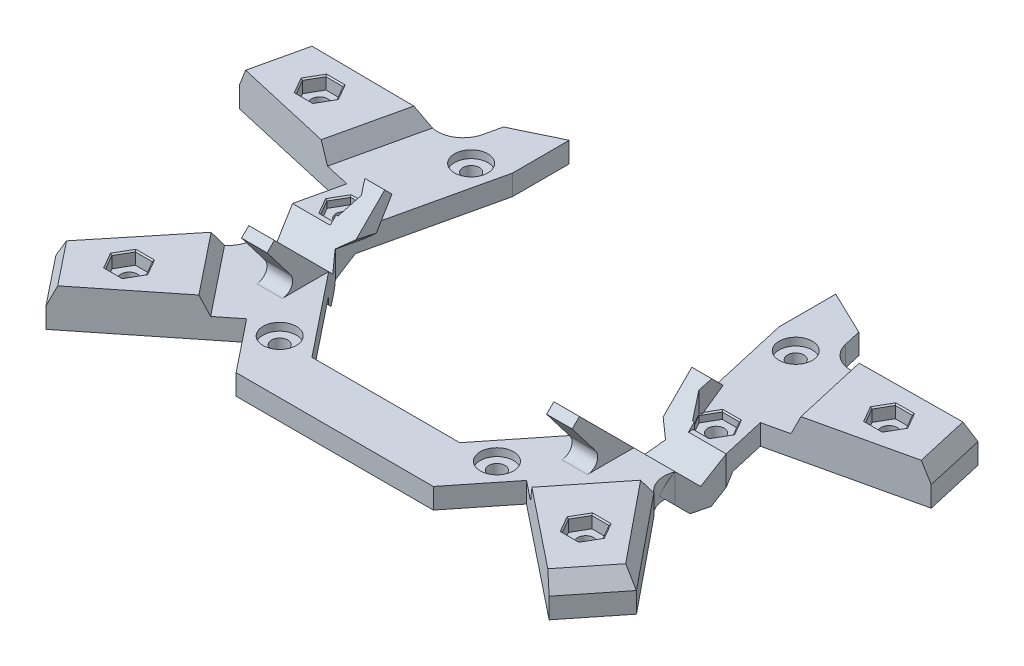
from build123d import *
from OCP.BRepFilletAPI import BRepFilletAPI_MakeChamfer

# Parameters (mm, degrees)
EXTRUDE_BASE_DEPTH  = 4
SKETCH16_R          = 1.6
CUT_EXTRUDE7_DEPTH  = 83.567171703
SKETCH17_R          = 2.85
CUT_EXTRUDE8_DEPTH  = 3
CUT_EXTRUDE9_DEPTH  = 83.567171703
SKETCH19_W          = 52.066048694
SKETCH19_H          = 44.396650567
CUT_EXTRUDE10_DEPTH = 83.567171703
CUT_EXTRUDE11_DEPTH = 45
BOSS_EXTRUDE1_START = -43.283534
BOSS_EXTRUDE1_DEPTH = 15.980374
BOSS_EXTRUDE2_START = 27.30316
BOSS_EXTRUDE2_DEPTH = 15.980374
CUT_EXTRUDE12_DEPTH = 83.857334274
CUT_EXTRUDE6_DEPTH  = 83.857334284
CUT_EXTRUDE13_DEPTH = 1.5
BOSS_EXTRUDE3_DEPTH = 3.5
SKETCH25_R          = 1.6
CUT_EXTRUDE14_DEPTH = 7.5
CUT_EXTRUDE15_DEPTH = 2.5
CHAMFER1_SIZE       = 1.632076804
CHAMFER1_SIZE_2     = 3.5
CHAMFER2_SIZE       = 0.25
SKETCH27_R          = 3.25
CUT_EXTRUDE16_DEPTH = 1.5
BOSS_EXTRUDE4_START = 27.30316
BOSS_EXTRUDE4_DEPTH = 5
BOSS_EXTRUDE5_START = -27.30316
BOSS_EXTRUDE5_DEPTH = 5
FILLET1_R           = 2
BOSS_EXTRUDE6_START = 30
BOSS_EXTRUDE6_DEPTH = 5
BOSS_EXTRUDE7_START = -30
BOSS_EXTRUDE7_DEPTH = 5
CUT_EXTRUDE17_DEPTH = 15
CHAMFER3_SIZE       = 2
SKETCH28_W          = 3.348631561
SKETCH28_H          = 0.74163265
SKETCH28_W_2        = 3.350976015
SKETCH28_H_2        = 1.173220137
CUT_EXTRUDE18_DEPTH = 5


# Some blends are built 0.0001 mm under size
with BuildPart() as part:
    # Sketch2 → Extrude_Base (new body)
    with BuildSketch(Plane(origin=(0, 0, 0), x_dir=(1, 0, 0), z_dir=(0, 1, 0))):
        with BuildLine():
            Line((-49.150553593, -47.254260988), (-27.345273547, -29.865130414))
            Line((-27.345273547, -29.865130414), (-19.262984752, -40))
            Line((-19.262984752, -40), (19.262984752, -40))
            Line((19.262984752, -40), (27.345273547, -29.865130414))
            Line((27.345273547, -29.865130414), (49.150553593, -47.254260988))
            Line((49.150553593, -47.254260988), (56.719719788, -37.762826791))
            Line((56.719719788, -37.762826791), (41.941046163, -19.581987814))
            ThreePointArc((41.941046163, -19.581987814), (40.089934123, -16.232652782), (41.14933776, -12.555381392))
            Line((41.14933776, -12.555381392), (43.283533845, -9.879184149))
            Line((43.283533845, -9.879184149), (40.398998371, 2.758791512))
            Line((40.398998371, 2.758791512), (67.589737842, 8.96490036))
            Line((67.589737842, 8.96490036), (64.888333704, 20.800525213))
            Line((64.888333704, 20.800525213), (41.459629124, 20.581660596))
            ThreePointArc((41.459629124, 20.581660596), (37.686864072, 21.222679161), (35.472384893, 24.343695487))
            Line((35.472384893, 24.343695487), (34.710699129, 27.680858865))
            Line((34.710699129, 27.680858865), (0, 44.396650567))
            Line((0, 44.396650567), (-34.710699129, 27.680858865))
            Line((-34.710699129, 27.680858865), (-35.472384893, 24.343695487))
            ThreePointArc((-35.472384893, 24.343695487), (-37.686864072, 21.222679161), (-41.459629124, 20.581660596))
            Line((-41.459629124, 20.581660596), (-64.888333704, 20.800525213))
            Line((-64.888333704, 20.800525213), (-67.589737842, 8.96490036))
            Line((-67.589737842, 8.96490036), (-40.398998371, 2.758791512))
            Line((-40.398998371, 2.758791512), (-43.283533845, -9.879184149))
            Line((-43.283533845, -9.879184149), (-41.14933776, -12.555381392))
            ThreePointArc((-41.14933776, -12.555381392), (-40.089934123, -16.232652782), (-41.941046163, -19.581987814))
            Line((-41.941046163, -19.581987814), (-56.719719788, -37.762826791))
            Line((-56.719719788, -37.762826791), (-49.150553593, -47.254260988))
        make_face()
    extrude(amount=EXTRUDE_BASE_DEPTH)

    # Sketch16 → Cut-Extrude7 (cut, through all)
    with BuildSketch(Plane(origin=(0, 4, 0), x_dir=(1, 0, 0), z_dir=(0, 1, 0))):
        with Locations(Location((-55.61963739, 12.694819282, 0), (0, 0, 270))):
            Circle(SKETCH16_R)
        with Locations(Location((55.61963739, 12.694819282, 0), (0, 0, 270))):
            Circle(SKETCH16_R)
        with Locations(Location((44.603486075, -35.570093196, 0), (0, 0, 270))):
            Circle(SKETCH16_R)
        with Locations(Location((-44.603486075, -35.570093196, 0), (0, 0, 270))):
            Circle(SKETCH16_R)
    extrude(amount=-CUT_EXTRUDE7_DEPTH, mode=Mode.SUBTRACT)

    # Sketch17 → Cut-Extrude8 (cut)
    with BuildSketch(Plane.XZ):
        with Locations(Location((-44.603486075, 35.570093196, 0), (0, 0, 270))):
            Circle(SKETCH17_R)
        with Locations(Location((55.61963739, -12.694819282, 0), (0, 0, 270))):
            Circle(SKETCH17_R)
        with Locations(Location((44.603486075, 35.570093196, 0), (0, 0, 270))):
            Circle(SKETCH17_R)
        with Locations(Location((-55.61963739, -12.694819282, 0), (0, 0, 270))):
            Circle(SKETCH17_R)
    extrude(amount=-CUT_EXTRUDE8_DEPTH, mode=Mode.SUBTRACT)

    # Sketch18 → Cut-Extrude9 (cut, through all)
    with BuildSketch(Plane(origin=(0, 4, 0), x_dir=(1, 0, 0), z_dir=(0, 1, 0))):
        Polygon((14.447238564, -30), (32.462650384, -7.409388112), (26.033024347, 20.760644149), (0, 33.297487925), (-26.033024347, 20.760644149), (-32.462650384, -7.409388112), (-14.447238564, -30), align=None)
    extrude(amount=-CUT_EXTRUDE9_DEPTH, mode=Mode.SUBTRACT)

    # Sketch19 → Cut-Extrude10 (cut, through all)
    with BuildSketch(Plane(origin=(0, 4, 0), x_dir=(1, 0, 0), z_dir=(0, 1, 0))):
        with Locations((0, 22.198325284)):
            Rectangle(SKETCH19_W, SKETCH19_H)
    extrude(amount=-CUT_EXTRUDE10_DEPTH, mode=Mode.SUBTRACT)

    # Sketch20 → Cut-Extrude11 (cut, symmetric)
    with BuildSketch(Plane(origin=(0, 0, 0), x_dir=(0, 0, -1), z_dir=(1, 0, 0))):
        Polygon((-2.855126894, 7.024057254), (-9.879184149, 0), (-16.903241403, 7.024057254), align=None)
    extrude(amount=CUT_EXTRUDE11_DEPTH, both=True, mode=Mode.SUBTRACT)


with BuildPart() as cut_extrude11_piece_1:
    # of the separate pieces the step leaves, piece 1, a body of its own (cut_extrude11_pieces)
    add(part.part.solids().sort_by_distance((-49.150553593, 0, 47.254260988))[0])



with BuildPart() as cut_extrude11_piece_2:
    # of the separate pieces the step leaves, piece 2, a body of its own (cut_extrude11_pieces)
    add(part.part.solids().sort_by_distance((32.462650384, 0, 7.409388112))[0])


with BuildPart() as cut_extrude11_piece_3:
    # of the separate pieces the step leaves, piece 3, a body of its own (cut_extrude11_pieces)
    add(part.part.solids().sort_by_distance((-40.398998371, 0, -2.758791512))[0])


with BuildPart() as cut_extrude11_piece_1_1:
    add(cut_extrude11_piece_1.part)

    add(cut_extrude11_piece_3.part)  # Boss-Extrude1 merges Cut-Extrude11 piece 3
    # Sketch20<3> → Boss-Extrude1 (add)
    with BuildSketch(Plane(origin=(0, 0, 0), x_dir=(0, 0, -1), z_dir=(1, 0, 0)).offset(BOSS_EXTRUDE1_START)):
        Polygon((-3.050757024, 1.171572875), (-5.879184149, 4), (-9.879184149, 0), (-13.879184149, 4), (-16.707611273, 1.171572875), (-11.536038398, -4), (-8.222329899, -4), align=None)
    extrude(amount=BOSS_EXTRUDE1_DEPTH)


    add(cut_extrude11_piece_2.part)  # Boss-Extrude2 merges Cut-Extrude11 piece 2
    # Sketch20<4> → Boss-Extrude2 (add)
    with BuildSketch(Plane(origin=(0, 0, 0), x_dir=(0, 0, -1), z_dir=(1, 0, 0)).offset(BOSS_EXTRUDE2_START)):
        Polygon((-3.050757024, 1.171572875), (-5.879184149, 4), (-9.879184149, 0), (-13.879184149, 4), (-16.707611273, 1.171572875), (-11.536038398, -4), (-8.222329899, -4), align=None)
    extrude(amount=BOSS_EXTRUDE2_DEPTH)

    # Sketch21 → Cut-Extrude12 (cut, through all)
    with BuildSketch(Plane(origin=(0, 4, 0), x_dir=(1, 0, 0), z_dir=(0, 1, 0))):
        with BuildLine():
            ThreePointArc((-40.058495173, -15.672830401), (-40.142397055, -14.760701407), (-40.391286893, -13.879184149))
            Line((-40.391286893, -13.879184149), (-42.370559948, -5.879184149))
            Line((-42.370559948, -5.879184149), (-40.398998371, 2.758791512))
            Line((-40.398998371, 2.758791512), (-45.604604003, 3.946937027))
            Line((-45.604604003, 3.946937027), (-47.84735204, -5.879184149))
            Line((-47.84735204, -5.879184149), (-44.042526576, -21.25786252))
            Line((-44.042526576, -21.25786252), (-43.640953756, -21.673227326))
            Line((-43.640953756, -21.673227326), (-41.941046163, -19.581987814))
            ThreePointArc((-41.941046163, -19.581987814), (-40.880219583, -18.419102984), (-40.233485879, -16.984045607))
            add(Edge.make_bspline(
                [(-40.233485879, -16.984045607), (-40.1185602, -16.556537494), (-40.059500768, -16.114823163), (-40.058495173, -15.672830401)],
                knots=[0.496944548, 0.496944548, 0.496944548, 0.496944548, 0.70839714, 0.70839714, 0.70839714, 0.70839714], degree=3))
        make_face()
        Polygon((-14.447238564, -30), (14.447238564, -30), (27.303160213, -13.879184149), (32.462650384, -7.409388112), (26.033024347, 20.760644149), (0, 33.297487925), (-26.033024347, 20.760644149), (-32.462650384, -7.409388112), (-27.303160213, -13.879184149), align=None)
        with BuildLine():
            add(Edge.make_bspline(
                [(41.941046163, -19.581987814), (39.300805229, -17.237505233), (40.391286893, -13.879184149)],
                knots=[0, 0, 0, 1, 1, 1], degree=2))
            Line((40.391286893, -13.879184149), (42.370559948, -5.879184149))
            Line((42.370559948, -5.879184149), (40.398998371, 2.758791512))
            Line((40.398998371, 2.758791512), (45.604604003, 3.946937027))
            Line((45.604604003, 3.946937027), (47.84735204, -5.879184149))
            Line((47.84735204, -5.879184149), (44.042526576, -21.25786252))
            Line((44.042526576, -21.25786252), (41.941046163, -19.581987814))
        make_face()
    extrude(amount=-CUT_EXTRUDE12_DEPTH, mode=Mode.SUBTRACT)

    # Sketch15 → Cut-Extrude6 (cut, through all)
    with BuildSketch(Plane(origin=(0, 4, 0), x_dir=(1, 0, 0), z_dir=(0, 1, 0))):
        with BuildLine():
            ThreePointArc((-31.350953848, 19.931068693), (-33.266872001, 18.727217528), (-32.063020836, 16.811299374))
            Line((-32.063020836, 16.811299374), (-31.350953848, 19.931068693))
        make_face()
        with BuildLine():
            Line((-31.350953848, 19.931068693), (-32.063020836, 16.811299374))
            ThreePointArc((-32.063020836, 16.811299374), (-30.709403659, 17.120253662), (-30.106987342, 18.371184034))
            ThreePointArc((-30.106987342, 18.371184034), (-30.45605697, 19.368767717), (-31.350953848, 19.931068693))
        make_face()
        with BuildLine():
            ThreePointArc((-35.959412082, -0.259906085), (-37.875330236, -1.463757251), (-36.671479071, -3.379675404))
            Line((-36.671479071, -3.379675404), (-35.959412082, -0.259906085))
        make_face()
        with BuildLine():
            Line((-35.959412082, -0.259906085), (-36.671479071, -3.379675404))
            ThreePointArc((-36.671479071, -3.379675404), (-35.317861894, -3.070721117), (-34.715445577, -1.819790745))
            ThreePointArc((-34.715445577, -1.819790745), (-35.064515205, -0.822207062), (-35.959412082, -0.259906085))
        make_face()
        with BuildLine():
            ThreePointArc((35.959412082, -0.259906085), (34.755560917, -2.175824239), (36.671479071, -3.379675404))
            Line((36.671479071, -3.379675404), (35.959412082, -0.259906085))
        make_face()
        with BuildLine():
            Line((35.959412082, -0.259906085), (36.671479071, -3.379675404))
            ThreePointArc((36.671479071, -3.379675404), (37.566375949, -2.817374428), (37.915445577, -1.819790745))
            ThreePointArc((37.915445577, -1.819790745), (37.31302926, -0.568860373), (35.959412082, -0.259906085))
        make_face()
        with BuildLine():
            ThreePointArc((31.350953848, 19.931068693), (30.147102682, 18.01515054), (32.063020836, 16.811299374))
            Line((32.063020836, 16.811299374), (31.350953848, 19.931068693))
        make_face()
        with BuildLine():
            Line((31.350953848, 19.931068693), (32.063020836, 16.811299374))
            ThreePointArc((32.063020836, 16.811299374), (32.957917714, 17.373600351), (33.306987342, 18.371184034))
            ThreePointArc((33.306987342, 18.371184034), (32.704571025, 19.622114406), (31.350953848, 19.931068693))
        make_face()
        with BuildLine():
            ThreePointArc((-22.217123954, -28.276249251), (-22.470470643, -30.524763306), (-20.221956588, -30.778109995))
            Line((-20.221956588, -30.778109995), (-22.217123954, -28.276249251))
        make_face()
        with BuildLine():
            Line((-22.217123954, -28.276249251), (-20.221956588, -30.778109995))
            ThreePointArc((-20.221956588, -30.778109995), (-19.777990083, -30.221393605), (-19.619540271, -29.527179623))
            ThreePointArc((-19.619540271, -29.527179623), (-20.525326289, -28.085629434), (-22.217123954, -28.276249251))
        make_face()
        with BuildLine():
            ThreePointArc((22.217123954, -28.276249251), (19.968609899, -28.52959594), (20.221956588, -30.778109995))
            Line((20.221956588, -30.778109995), (22.217123954, -28.276249251))
        make_face()
        with BuildLine():
            Line((22.217123954, -28.276249251), (20.221956588, -30.778109995))
            ThreePointArc((20.221956588, -30.778109995), (21.913754254, -30.968729811), (22.819540271, -29.527179623))
            ThreePointArc((22.819540271, -29.527179623), (22.66109046, -28.83296564), (22.217123954, -28.276249251))
        make_face()
    extrude(amount=-CUT_EXTRUDE6_DEPTH, mode=Mode.SUBTRACT)

    # Sketch22 → Cut-Extrude13 (cut)
    with BuildSketch(Plane(origin=(0, 4, 0), x_dir=(1, 0, 0), z_dir=(0, 1, 0))):
        Polygon((-34.641129796, -4.719790745), (-32.966814016, -1.819790745), (-34.641129796, 1.080209255), (-37.989761357, 1.080209255), (-39.664077138, -1.819790745), (-37.989761357, -4.719790745), align=None)
        Polygon((37.989761357, -4.719790745), (39.664077138, -1.819790745), (37.989761357, 1.080209255), (34.641129796, 1.080209255), (32.966814016, -1.819790745), (34.641129796, -4.719790745), align=None)
    extrude(amount=-CUT_EXTRUDE13_DEPTH, mode=Mode.SUBTRACT)

    # Sketch24 → Boss-Extrude3 (add)
    with BuildSketch(Plane(origin=(0, 4, 0), x_dir=(1, 0, 0), z_dir=(0, 1, 0))):
        Polygon((-67.589737842, 8.96490036), (-64.888333704, 20.800525213), (-41.459629124, 20.581660596), (-45.273637932, 3.871396181), align=None)
        Polygon((-56.719719788, -37.762826791), (-41.941046163, -19.581987814), (-31.254430959, -32.982579423), (-49.150553593, -47.254260988), align=None)
        Polygon((49.150553593, -47.254260988), (56.719719788, -37.762826791), (41.941046163, -19.581987814), (31.254430959, -32.982579423), align=None)
        Polygon((45.273637932, 3.871396181), (67.589737842, 8.96490036), (64.888333704, 20.800525213), (41.459629124, 20.581660596), align=None)
    extrude(amount=BOSS_EXTRUDE3_DEPTH)

    # Sketch25 → Cut-Extrude14 (cut)
    with BuildSketch(Plane.XZ):
        with Locations(Location((-44.603486075, 35.570093196, 0), (0, 0, 270))):
            Circle(SKETCH25_R)
        with Locations(Location((44.603486075, 35.570093196, 0), (0, 0, 270))):
            Circle(SKETCH25_R)
        with Locations(Location((55.61963739, -12.694819282, 0), (0, 0, 270))):
            Circle(SKETCH25_R)
        with Locations(Location((-55.61963739, -12.694819282, 0), (0, 0, 270))):
            Circle(SKETCH25_R)
    extrude(amount=-CUT_EXTRUDE14_DEPTH, mode=Mode.SUBTRACT)

    # Sketch26 → Cut-Extrude15 (cut)
    with BuildSketch(Plane(origin=(0, 7.5, 0), x_dir=(1, 0, 0), z_dir=(0, 1, 0))):
        Polygon((53.945321609, 15.594819282), (52.271005829, 12.694819282), (53.945321609, 9.794819282), (57.293953171, 9.794819282), (58.968268951, 12.694819282), (57.293953171, 15.594819282), align=None)
        Polygon((42.929170294, -32.670093196), (41.254854514, -35.570093196), (42.929170294, -38.470093196), (46.277801855, -38.470093196), (47.952117636, -35.570093196), (46.277801855, -32.670093196), align=None)
        Polygon((-42.929170294, -38.470093196), (-41.254854514, -35.570093196), (-42.929170294, -32.670093196), (-46.277801855, -32.670093196), (-47.952117636, -35.570093196), (-46.277801855, -38.470093196), align=None)
        Polygon((-57.293953171, 15.594819282), (-58.968268951, 12.694819282), (-57.293953171, 9.794819282), (-53.945321609, 9.794819282), (-52.271005829, 12.694819282), (-53.945321609, 15.594819282), align=None)
    extrude(amount=-CUT_EXTRUDE15_DEPTH, mode=Mode.SUBTRACT)

    # Chamfer1
    chamfer1_edges_1 = [cut_extrude11_piece_1_1.edges().sort_by_distance(p)[0] for p in [
        (-43.366633528, 7.5, -12.226528389),
    ]]
    chamfer1_side_1 = [cut_extrude11_piece_1_1.faces().sort_by_distance(p)[0] for p in [
        (-43.398456673, 7.5, -12.233791814),
    ]]
    chamfer1_edges_2 = [cut_extrude11_piece_1_1.edges().sort_by_distance(p)[0] for p in [
        (-53.173981414, 7.5, -20.691092905),
    ]]
    chamfer1_side_2 = [cut_extrude11_piece_1_1.faces().sort_by_distance(p)[0] for p in [
        (-53.173981414, 7.467358464, -20.691092905),
    ]]
    chamfer1_edges_3 = [cut_extrude11_piece_1_1.edges().sort_by_distance(p)[0] for p in [
        (-66.239035773, 7.5, -14.882712786),
    ]]
    chamfer1_side_3 = [cut_extrude11_piece_1_1.faces().sort_by_distance(p)[0] for p in [
        (-66.239035773, 7.467358464, -14.882712786),
    ]]
    chamfer1_edges_4 = [cut_extrude11_piece_1_1.edges().sort_by_distance(p)[0] for p in [
        (-52.93513669, 7.5, 42.508543889),
    ]]
    chamfer1_side_4 = [cut_extrude11_piece_1_1.faces().sort_by_distance(p)[0] for p in [
        (-52.90961651, 7.5, 42.488192224),
    ]]
    chamfer1_edges_5 = [cut_extrude11_piece_1_1.edges().sort_by_distance(p)[0] for p in [
        (-36.597738561, 7.5, 26.282283618),
    ]]
    chamfer1_side_5 = [cut_extrude11_piece_1_1.faces().sort_by_distance(p)[0] for p in [
        (-36.597738561, 7.467358464, 26.282283618),
    ]]
    chamfer1_edges_6 = [cut_extrude11_piece_1_1.edges().sort_by_distance(p)[0] for p in [
        (-49.330382975, 7.5, 28.672407302),
    ]]
    chamfer1_side_6 = [cut_extrude11_piece_1_1.faces().sort_by_distance(p)[0] for p in [
        (-49.30505402, 7.5, 28.692996471),
    ]]
    chamfer1_edges_7 = [cut_extrude11_piece_1_1.edges().sort_by_distance(p)[0] for p in [
        (52.93513669, 7.5, 42.508543889),
    ]]
    chamfer1_side_7 = [cut_extrude11_piece_1_1.faces().sort_by_distance(p)[0] for p in [
        (52.93513669, 7.467358464, 42.508543889),
    ]]
    chamfer1_edges_8 = [cut_extrude11_piece_1_1.edges().sort_by_distance(p)[0] for p in [
        (49.330382975, 7.5, 28.672407302),
    ]]
    chamfer1_side_8 = [cut_extrude11_piece_1_1.faces().sort_by_distance(p)[0] for p in [
        (49.30505402, 7.5, 28.692996471),
    ]]
    chamfer1_edges_9 = [cut_extrude11_piece_1_1.edges().sort_by_distance(p)[0] for p in [
        (36.597738561, 7.5, 26.282283618),
    ]]
    chamfer1_side_9 = [cut_extrude11_piece_1_1.faces().sort_by_distance(p)[0] for p in [
        (36.623258742, 7.5, 26.302635283),
    ]]
    chamfer1_edges_10 = [cut_extrude11_piece_1_1.edges().sort_by_distance(p)[0] for p in [
        (43.366633528, 7.5, -12.226528389),
    ]]
    chamfer1_side_10 = [cut_extrude11_piece_1_1.faces().sort_by_distance(p)[0] for p in [
        (43.398456673, 7.5, -12.233791814),
    ]]
    chamfer1_edges_11 = [cut_extrude11_piece_1_1.edges().sort_by_distance(p)[0] for p in [
        (66.239035773, 7.5, -14.882712786),
    ]]
    chamfer1_side_11 = [cut_extrude11_piece_1_1.faces().sort_by_distance(p)[0] for p in [
        (66.207212628, 7.5, -14.875449361),
    ]]
    chamfer1_edges_12 = [cut_extrude11_piece_1_1.edges().sort_by_distance(p)[0] for p in [
        (53.173981414, 7.5, -20.691092905),
    ]]
    chamfer1_side_12 = [cut_extrude11_piece_1_1.faces().sort_by_distance(p)[0] for p in [
        (53.174286329, 7.5, -20.658452793),
    ]]
    chamfer1 = BRepFilletAPI_MakeChamfer(cut_extrude11_piece_1_1.part.solid().wrapped)
    for e in chamfer1_edges_1:
        chamfer1.Add(CHAMFER1_SIZE - 0.0001, CHAMFER1_SIZE_2 - 0.0001, e.wrapped, chamfer1_side_1[0].wrapped)
    for e in chamfer1_edges_2:
        chamfer1.Add(CHAMFER1_SIZE_2 - 0.0001, CHAMFER1_SIZE - 0.0001, e.wrapped, chamfer1_side_2[0].wrapped)
    for e in chamfer1_edges_3:
        chamfer1.Add(CHAMFER1_SIZE_2 - 0.0001, CHAMFER1_SIZE - 0.0001, e.wrapped, chamfer1_side_3[0].wrapped)
    for e in chamfer1_edges_4:
        chamfer1.Add(CHAMFER1_SIZE - 0.0001, CHAMFER1_SIZE_2 - 0.0001, e.wrapped, chamfer1_side_4[0].wrapped)
    for e in chamfer1_edges_5:
        chamfer1.Add(CHAMFER1_SIZE_2 - 0.0001, CHAMFER1_SIZE - 0.0001, e.wrapped, chamfer1_side_5[0].wrapped)
    for e in chamfer1_edges_6:
        chamfer1.Add(CHAMFER1_SIZE - 0.0001, CHAMFER1_SIZE_2 - 0.0001, e.wrapped, chamfer1_side_6[0].wrapped)
    for e in chamfer1_edges_7:
        chamfer1.Add(CHAMFER1_SIZE_2 - 0.0001, CHAMFER1_SIZE - 0.0001, e.wrapped, chamfer1_side_7[0].wrapped)
    for e in chamfer1_edges_8:
        chamfer1.Add(CHAMFER1_SIZE - 0.0001, CHAMFER1_SIZE_2 - 0.0001, e.wrapped, chamfer1_side_8[0].wrapped)
    for e in chamfer1_edges_9:
        chamfer1.Add(CHAMFER1_SIZE - 0.0001, CHAMFER1_SIZE_2 - 0.0001, e.wrapped, chamfer1_side_9[0].wrapped)
    for e in chamfer1_edges_10:
        chamfer1.Add(CHAMFER1_SIZE - 0.0001, CHAMFER1_SIZE_2 - 0.0001, e.wrapped, chamfer1_side_10[0].wrapped)
    for e in chamfer1_edges_11:
        chamfer1.Add(CHAMFER1_SIZE - 0.0001, CHAMFER1_SIZE_2 - 0.0001, e.wrapped, chamfer1_side_11[0].wrapped)
    for e in chamfer1_edges_12:
        chamfer1.Add(CHAMFER1_SIZE - 0.0001, CHAMFER1_SIZE_2 - 0.0001, e.wrapped, chamfer1_side_12[0].wrapped)
    add(Compound.cast(chamfer1.Shape()), mode=Mode.REPLACE)  # a hair under: the kernel refuses the full size

    # Chamfer2
    chamfer2_edges = [cut_extrude11_piece_1_1.edges().sort_by_distance(p)[0] for p in [
        (-36.315445577, 4, 4.719790745),
        (-33.803971906, 4, 3.269790745),
        (-33.803971906, 4, 0.369790745),
        (-36.315445577, 4, -1.080209255),
        (-38.826919248, 4, 0.369790745),
        (-38.826919248, 4, 3.269790745),
        (36.315445577, 4, 4.719790745),
        (38.826919248, 4, 3.269790745),
        (38.826919248, 4, 0.369790745),
        (36.315445577, 4, -1.080209255),
        (33.803971906, 4, 0.369790745),
        (33.803971906, 4, 3.269790745),
        (55.61963739, 7.5, -15.594819282),
        (53.108163719, 7.5, -14.144819282),
        (53.108163719, 7.5, -11.244819282),
        (55.61963739, 7.5, -9.794819282),
        (58.131111061, 7.5, -11.244819282),
        (58.131111061, 7.5, -14.144819282),
        (44.603486075, 7.5, 32.670093196),
        (42.092012404, 7.5, 34.120093196),
        (42.092012404, 7.5, 37.020093196),
        (44.603486075, 7.5, 38.470093196),
        (47.114959746, 7.5, 37.020093196),
        (47.114959746, 7.5, 34.120093196),
        (-44.603486075, 7.5, 38.470093196),
        (-42.092012404, 7.5, 37.020093196),
        (-42.092012404, 7.5, 34.120093196),
        (-44.603486075, 7.5, 32.670093196),
        (-47.114959746, 7.5, 34.120093196),
        (-47.114959746, 7.5, 37.020093196),
        (-55.61963739, 7.5, -15.594819282),
        (-58.131111061, 7.5, -14.144819282),
        (-58.131111061, 7.5, -11.244819282),
        (-55.61963739, 7.5, -9.794819282),
        (-53.108163719, 7.5, -11.244819282),
        (-53.108163719, 7.5, -14.144819282),
    ]]
    chamfer(chamfer2_edges, length=CHAMFER2_SIZE)

    # Sketch27 → Cut-Extrude16 (cut)
    with BuildSketch(Plane(origin=(0, 4, 0), x_dir=(1, 0, 0), z_dir=(0, 1, 0))):
        with Locations(Location((-31.706987342, 18.371184034, 0), (0, 0, 270))):
            Circle(SKETCH27_R)
        with Locations(Location((31.706987342, 18.371184034, 0), (0, 0, 270))):
            Circle(SKETCH27_R)
        with Locations(Location((-21.219540271, -29.527179623, 0), (0, 0, 270))):
            Circle(SKETCH27_R)
        with Locations(Location((21.219540271, -29.527179623, 0), (0, 0, 270))):
            Circle(SKETCH27_R)
    extrude(amount=-CUT_EXTRUDE16_DEPTH, mode=Mode.SUBTRACT)

    # Sketch20<5> → Boss-Extrude4 (add)
    with BuildSketch(Plane(origin=(0, 0, 0), x_dir=(0, 0, -1), z_dir=(1, 0, 0)).offset(BOSS_EXTRUDE4_START)):
        Polygon((-13.879184149, 4), (-16.903241403, 7.024057254), (-24.485785866, 14.606601718), (-25.899999429, 13.192388155), (-16.707611273, 1.171572875), align=None)
    extrude(amount=BOSS_EXTRUDE4_DEPTH)

    # Sketch20<6> → Boss-Extrude5 (add)
    with BuildSketch(Plane(origin=(0, 0, 0), x_dir=(0, 0, -1), z_dir=(1, 0, 0)).offset(BOSS_EXTRUDE5_START)):
        Polygon((-13.879184149, 4), (-16.903241403, 7.024057254), (-24.485785866, 14.606601718), (-25.899999429, 13.192388155), (-16.707611273, 1.171572875), align=None)
    extrude(amount=-BOSS_EXTRUDE5_DEPTH)

    # Fillet1
    fillet1_edges = [cut_extrude11_piece_1_1.edges().sort_by_distance(p)[0] for p in [
        (29.80316, 4, 18.870526134),
        (-29.80316, 4, 18.870526134),
    ]]
    fillet(fillet1_edges, radius=FILLET1_R)

    # Sketch20<8> → Boss-Extrude6 (add)
    with BuildSketch(Plane(origin=(0, 0, 0), x_dir=(0, 0, -1), z_dir=(1, 0, 0)).offset(BOSS_EXTRUDE6_START)):
        Polygon((-0.222329899, 9.656854249), (-2.855126894, 7.024057254), (-5.879184149, 4), (-1.353700749, 4), (1.191883663, 8.242640687), align=None)
    extrude(amount=BOSS_EXTRUDE6_DEPTH)

    # Sketch20<9> → Boss-Extrude7 (add)
    with BuildSketch(Plane(origin=(0, 0, 0), x_dir=(0, 0, -1), z_dir=(1, 0, 0)).offset(BOSS_EXTRUDE7_START)):
        Polygon((-0.222329899, 9.656854249), (-2.855126894, 7.024057254), (-5.879184149, 4), (-1.353700749, 4), (1.191883663, 8.242640687), align=None)
    extrude(amount=-BOSS_EXTRUDE7_DEPTH)

    # Sketch22<2> → Cut-Extrude17 (cut)
    with BuildSketch(Plane(origin=(0, 4, 0), x_dir=(1, 0, 0), z_dir=(0, 1, 0))):
        Polygon((-34.641129796, -4.719790745), (-32.966814016, -1.819790745), (-34.641129796, 1.080209255), (-37.989761357, 1.080209255), (-39.664077138, -1.819790745), (-37.989761357, -4.719790745), align=None)
        Polygon((37.989761357, -4.719790745), (39.664077138, -1.819790745), (37.989761357, 1.080209255), (34.641129796, 1.080209255), (32.966814016, -1.819790745), (34.641129796, -4.719790745), align=None)
    extrude(amount=CUT_EXTRUDE17_DEPTH, mode=Mode.SUBTRACT)

    # Chamfer3
    # the kernel refuses this chamfer: 2 mm, written as the material it adds along each edge
    with BuildSketch(Plane(origin=(33.257897915, 4, 10.893595201), x_dir=(0.026806497577567524, -0.9996219169112968, -0.00611840814333515), z_dir=(-0.22252093395631442, 0, -0.9749279121818236))) as chamfer3_piece_1_section:
        Polygon((CHAMFER3_SIZE * 0.999621916911, CHAMFER3_SIZE * 0.0274958766106), (-CHAMFER3_SIZE * 0.0274958766106, CHAMFER3_SIZE * 0.999621916911), (0, 0), align=None)
    chamfer3_piece_1 = extrude(amount=14.928596589, mode=Mode.PRIVATE)
    chamfer3_piece_1 = split(chamfer3_piece_1, bisect_by=Plane(origin=(31.126648728, 4.451626066, 5.427558083), z_dir=(0, -0.7071067811865461, -0.7071067811865489)), keep=Keep.TOP, mode=Mode.PRIVATE)
    chamfer3_piece_1 = split(chamfer3_piece_1, bisect_by=Plane(origin=(30, 3.286254946, 4.262186963), z_dir=(1, 0, 0)), keep=Keep.TOP, mode=Mode.PRIVATE)
    chamfer3_piece_1 = split(chamfer3_piece_1, bisect_by=Plane(origin=(31.126648728, 2.192031778, 2.438481683), z_dir=(0, 0.5144957554275239, 0.8574929257125458)), keep=Keep.TOP, mode=Mode.PRIVATE)
    add(chamfer3_piece_1)
    with BuildSketch(Plane(origin=(-29.93597266, 4, -3.660710303), x_dir=(-0.026806497577567194, -0.9996219169112968, -0.006118408143335074), z_dir=(-0.2225209339563144, 0, 0.9749279121818236))) as chamfer3_piece_2_section:
        Polygon((CHAMFER3_SIZE * 0.999621916911, CHAMFER3_SIZE * 0.0274958766106), (-CHAMFER3_SIZE * 0.0274958766106, CHAMFER3_SIZE * 0.999621916911), (0, 0), align=None)
    chamfer3_piece_2 = extrude(amount=14.928596589, mode=Mode.PRIVATE)
    chamfer3_piece_2 = split(chamfer3_piece_2, bisect_by=Plane(origin=(-31.126648728, 4.451626066, 5.427558083), z_dir=(0, -0.7071067811865461, -0.7071067811865489)), keep=Keep.TOP, mode=Mode.PRIVATE)
    chamfer3_piece_2 = split(chamfer3_piece_2, bisect_by=Plane(origin=(-30, 3.286254946, 4.262186963), z_dir=(-1, 0, 0)), keep=Keep.TOP, mode=Mode.PRIVATE)
    chamfer3_piece_2 = split(chamfer3_piece_2, bisect_by=Plane(origin=(-31.126648728, 2.192031778, 2.438481683), z_dir=(0, 0.5144957554275239, 0.8574929257125458)), keep=Keep.TOP, mode=Mode.PRIVATE)
    add(chamfer3_piece_2)

    # Sketch28 → Cut-Extrude18 (cut)
    with BuildSketch(Plane(origin=(0, 4, 0), x_dir=(1, 0, 0), z_dir=(0, 1, 0))):
        with Locations((36.315445576, 1.45102558)):
            Rectangle(SKETCH28_W, SKETCH28_H)
        with Locations((-36.316617804, 1.666819323)):
            Rectangle(SKETCH28_W_2, SKETCH28_H_2)
    extrude(amount=CUT_EXTRUDE18_DEPTH, mode=Mode.SUBTRACT)


solid = cut_extrude11_piece_1_1.part
